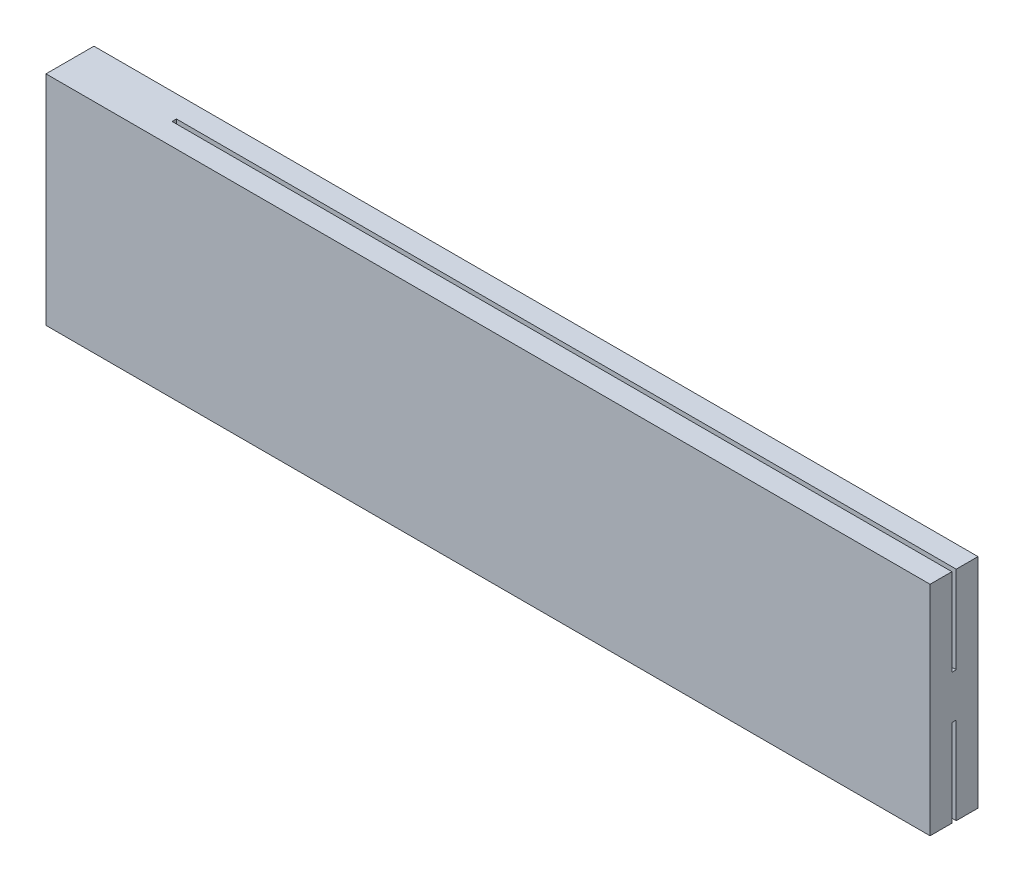
from build123d import *

# Parameters (mm, degrees)
BOSS_EXTRUDE1_DEPTH      = 166.889082
BOSS_EXTRUDE1_DEPTH_BACK = 238.865534
SKETCH1_W                = 22
SKETCH1_H                = 100
CAVITY1_START            = -191
CAVITY1_OUTLINE_W        = 40
CAVITY1_OUTLINE_H        = 2
CAVITY1_DEPTH            = 357.889082162


# Read off the part's stored shape, not the designer's step: Cavity1
with BuildPart() as part:
    # Sketch1 → Boss-Extrude1 (new, two sides: drawn at the far end of the back side and taken through both)
    with BuildSketch(Plane(origin=(0, 0, 0), x_dir=(0, 0, -1), z_dir=(1, 0, 0)).offset(-BOSS_EXTRUDE1_DEPTH_BACK)):
        with Locations((1, -190)):
            Rectangle(SKETCH1_W, SKETCH1_H)
    extrude(amount=BOSS_EXTRUDE1_DEPTH + BOSS_EXTRUDE1_DEPTH_BACK)

    # Cavity1 outline → Cavity1 (cut)
    with BuildSketch(Plane.YZ.offset(CAVITY1_START)):
        with Locations((-160, -1)):
            Rectangle(CAVITY1_OUTLINE_W, CAVITY1_OUTLINE_H)
    cavity1 = extrude(amount=CAVITY1_DEPTH, mode=Mode.SUBTRACT)

    # Mirror1: Cavity1 across plane
    add(cavity1.mirror(Plane.ZX.offset(-190)), mode=Mode.SUBTRACT)


solid = part.part
